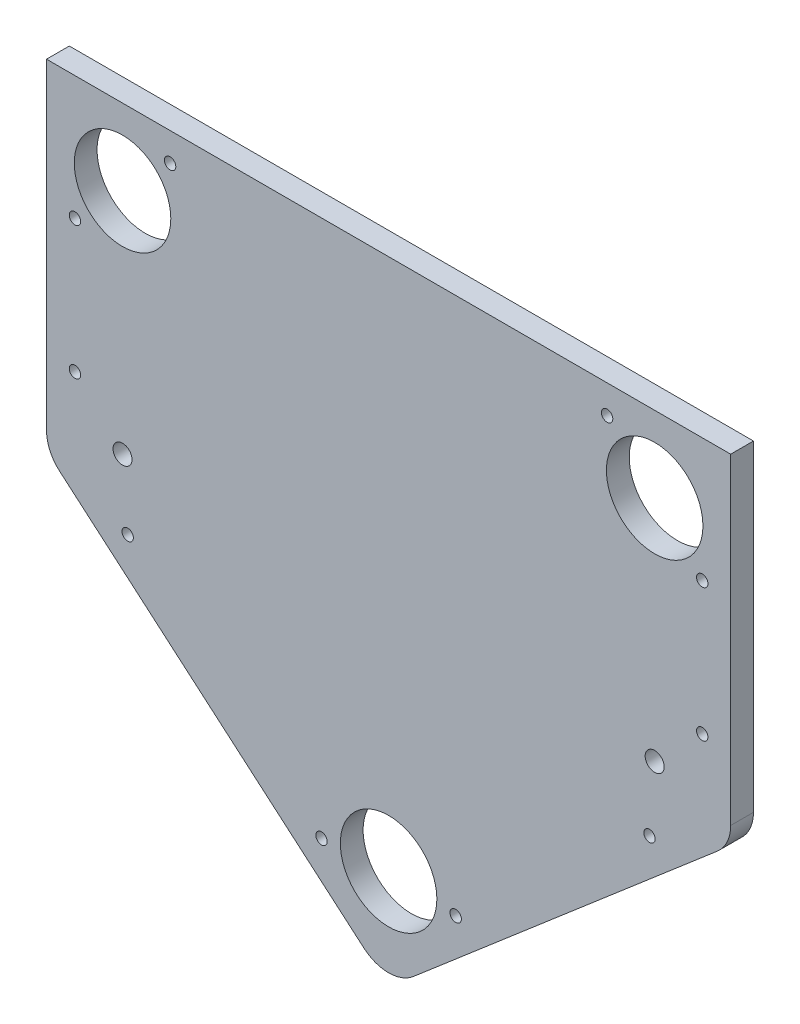
from build123d import *

# Parameters (mm, degrees)
SKETCH1_R           = 12.7
SKETCH1_R_2         = 2.5
SKETCH1_R_3         = 1.5
BOSS_EXTRUDE1_DEPTH = 6
FILLET1_R           = 10


with BuildPart() as part:
    # Sketch1 → Boss-Extrude1 (new body)
    with BuildSketch(Plane.XY):
        Polygon((-90, 80), (90, 80), (90, -9.198698449), (0, -86.341555592), (-90, -9.198698449), align=None)
        with Locations((-70, 60)):
            Circle(SKETCH1_R, mode=Mode.SUBTRACT)
        with Locations((70, 60)):
            Circle(SKETCH1_R, mode=Mode.SUBTRACT)
        with Locations((-70, 0)):
            Circle(SKETCH1_R_2, mode=Mode.SUBTRACT)
        with Locations((70, 0)):
            Circle(SKETCH1_R_2, mode=Mode.SUBTRACT)
        with Locations((0, -60)):
            Circle(SKETCH1_R, mode=Mode.SUBTRACT)
        with Locations((-82.515790027, 47.484209973)):
            Circle(SKETCH1_R_3, mode=Mode.SUBTRACT)
        with Locations((-57.484209973, 72.515790027)):
            Circle(SKETCH1_R_3, mode=Mode.SUBTRACT)
        with Locations((-82.515790027, 12.515790027)):
            Circle(SKETCH1_R_3, mode=Mode.SUBTRACT)
        with Locations((-68.64247197, -17.647864393)):
            Circle(SKETCH1_R_3, mode=Mode.SUBTRACT)
        with Locations((-17.647864393, -61.35752803)):
            Circle(SKETCH1_R_3, mode=Mode.SUBTRACT)
        with Locations((17.647864393, -61.35752803)):
            Circle(SKETCH1_R_3, mode=Mode.SUBTRACT)
        with Locations((68.64247197, -17.647864393)):
            Circle(SKETCH1_R_3, mode=Mode.SUBTRACT)
        with Locations((82.515790027, 12.515790027)):
            Circle(SKETCH1_R_3, mode=Mode.SUBTRACT)
        with Locations((82.515790027, 47.484209973)):
            Circle(SKETCH1_R_3, mode=Mode.SUBTRACT)
        with Locations((57.484209973, 72.515790027)):
            Circle(SKETCH1_R_3, mode=Mode.SUBTRACT)
    extrude(amount=BOSS_EXTRUDE1_DEPTH)

    # Fillet1
    fillet1_edges = [part.edges().sort_by_distance(p)[0] for p in [
        (-90, -9.198698449, 3),
        (90, -9.198698449, 3),
        (0, -86.341555592, 3),
    ]]
    fillet(fillet1_edges, radius=FILLET1_R)


solid = part.part
